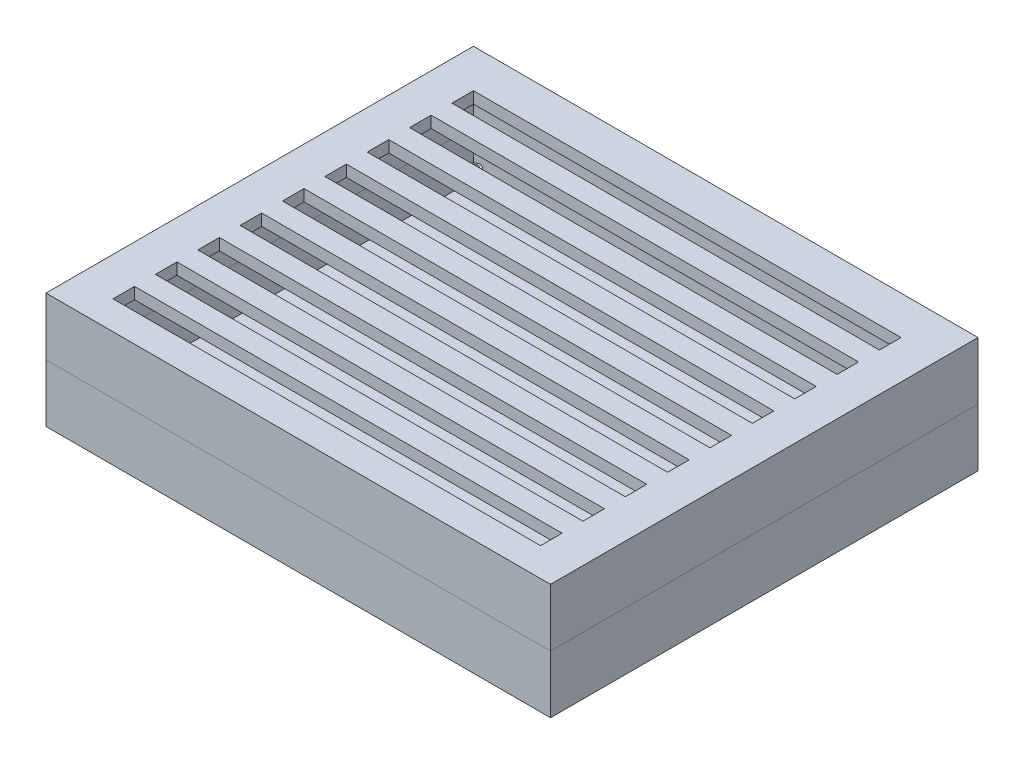
from build123d import *

# Parameters (mm, degrees)
ESBO_O1_W                    = 131
ESBO_O1_H                    = 111
ESBO_O1_W_2                  = 125
ESBO_O1_H_2                  = 105
RESSALTO_EXTRUS_O1_DEPTH     = 15
ESBO_O1_4_W                  = 125
ESBO_O1_4_H                  = 105
RESSALTO_EXTRUS_O4_DEPTH     = 3
ESBO_O2_R                    = 1.5
ESBO_O2_R_2                  = 1
RESSALTO_EXTRUS_O8_DEPTH     = 5
CORTE_EXTRUS_O4_DEPTH        = 2.5
CORTE_EXTRUS_O5_REACH        = 142.318
ESBO_O5_5_R                  = 1.5
CORTE_EXTRUS_O6_DEPTH        = 2.5
CORTE_EXTRUS_O7_REACH        = 129.198
ESBO_O8_7_R                  = 1.5
CORTE_EXTRUS_O9_DEPTH        = 2.5
CORTE_EXTRUS_O10_REACH       = 88.686
ESBO_O9_7_R                  = 1.5
RESSALTO_EXTRUS_O6_START     = 15
ESBO_O1_6_W                  = 131
ESBO_O1_6_H                  = 111
ESBO_O1_6_W_2                = 125
ESBO_O1_6_H_2                = 105
RESSALTO_EXTRUS_O6_DEPTH     = 15
RESSALTO_EXTRUS_O7_START     = 27
RESSALTO_EXTRUS_O7_OUTLINE_W = 125
RESSALTO_EXTRUS_O7_OUTLINE_H = 105
RESSALTO_EXTRUS_O7_DEPTH     = 3
ESBO_O3_W                    = 111
ESBO_O3_H                    = 5.592085676
CORTE_EXTRUS_O1_DEPTH        = 3


# Read off the part's stored shape, not the designer's step: Ressalto-extrusão7
with BuildPart() as part:
    # Esboço1 → Ressalto-extrusão1 (new body)
    with BuildSketch(Plane(origin=(0, 0, 0), x_dir=(1, 0, 0), z_dir=(0, 1, 0))):
        Rectangle(ESBO_O1_W, ESBO_O1_H)
        Rectangle(ESBO_O1_W_2, ESBO_O1_H_2, mode=Mode.SUBTRACT)
    extrude(amount=RESSALTO_EXTRUS_O1_DEPTH)

    # Esboço1<4> → Ressalto-extrusão4 (add)
    with BuildSketch(Plane(origin=(0, 0, 0), x_dir=(1, 0, 0), z_dir=(0, 1, 0))):
        Rectangle(ESBO_O1_4_W, ESBO_O1_4_H)
    extrude(amount=RESSALTO_EXTRUS_O4_DEPTH)

    # Esboço2 → Ressalto-extrusão8 (add)
    # profile 1 of 4: a face of its own
    with BuildSketch(Plane(origin=(0, 3, 0), x_dir=(1, 0, 0), z_dir=(0, 1, 0))):
        with Locations(Location((-60.1, 50.3, 0), (0, 0, 270))):
            Circle(ESBO_O2_R)
        with Locations(Location((-60.1, 50.3, 0), (0, 0, 270))):
            Circle(ESBO_O2_R_2, mode=Mode.SUBTRACT)
    # profile 2 of 4: a face of its own
    with BuildSketch(Plane(origin=(0, 3, 0), x_dir=(1, 0, 0), z_dir=(0, 1, 0))):
        with Locations(Location((60.1, 50.3, 0), (0, 0, 270))):
            Circle(ESBO_O2_R)
        with Locations(Location((60.1, 50.3, 0), (0, 0, 270))):
            Circle(ESBO_O2_R_2, mode=Mode.SUBTRACT)
    # profile 3 of 4: a face of its own
    with BuildSketch(Plane(origin=(0, 3, 0), x_dir=(1, 0, 0), z_dir=(0, 1, 0))):
        with Locations(Location((-60.1, -50.3, 0), (0, 0, 270))):
            Circle(ESBO_O2_R)
        with Locations(Location((-60.1, -50.3, 0), (0, 0, 270))):
            Circle(ESBO_O2_R_2, mode=Mode.SUBTRACT)
    # profile 4 of 4: a face of its own
    with BuildSketch(Plane(origin=(0, 3, 0), x_dir=(1, 0, 0), z_dir=(0, 1, 0))):
        with Locations(Location((60.1, -50.3, 0), (0, 0, 270))):
            Circle(ESBO_O2_R)
        with Locations(Location((60.1, -50.3, 0), (0, 0, 270))):
            Circle(ESBO_O2_R_2, mode=Mode.SUBTRACT)
    extrude(amount=RESSALTO_EXTRUS_O8_DEPTH)

    # Esboço5 → Corte-extrusão4 (cut)
    with BuildSketch(Plane(origin=(-62.5, 0, 0), x_dir=(0, 0, -1), z_dir=(1, 0, 0))):
        Polygon((-43.91228676, 6.25), (-42.324573519, 9), (-43.91228676, 11.75), (-47.08771324, 11.75), (-48.675426481, 9), (-47.08771324, 6.25), align=None)
    extrude(amount=-CORTE_EXTRUS_O4_DEPTH, mode=Mode.SUBTRACT)

    # Esboço5<5> → Corte-extrusão5 (cut, up to next)
    with BuildSketch(Plane(origin=(-62.5, 0, 0), x_dir=(0, 0, -1), z_dir=(1, 0, 0)), mode=Mode.PRIVATE) as corte_extrus_o5_sk1:
        with Locations((-45.5, 9)):
            Circle(ESBO_O5_5_R)
    corte_extrus_o5_tool1 = extrude(corte_extrus_o5_sk1.sketch, amount=-CORTE_EXTRUS_O5_REACH, mode=Mode.PRIVATE) & part.part
    add(corte_extrus_o5_tool1.solids().sort_by_distance((-62.5, 9, 45.5))[0], mode=Mode.SUBTRACT)

    # Esboço8 → Corte-extrusão6 (cut)
    with BuildSketch(Plane.XY.offset(-52.5)):
        Polygon((57.08771324, 6.25), (58.675426481, 9), (57.08771324, 11.75), (53.91228676, 11.75), (52.324573519, 9), (53.91228676, 6.25), align=None)
    extrude(amount=-CORTE_EXTRUS_O6_DEPTH, mode=Mode.SUBTRACT)

    # Esboço8<7> → Corte-extrusão7 (cut, up to next)
    with BuildSketch(Plane.XY.offset(-52.5), mode=Mode.PRIVATE) as corte_extrus_o7_sk1:
        with Locations((55.5, 9)):
            Circle(ESBO_O8_7_R)
    corte_extrus_o7_tool1 = extrude(corte_extrus_o7_sk1.sketch, amount=-CORTE_EXTRUS_O7_REACH, mode=Mode.PRIVATE) & part.part
    add(corte_extrus_o7_tool1.solids().sort_by_distance((55.5, 9, -52.5))[0], mode=Mode.SUBTRACT)

    # Esboço9 → Corte-extrusão9 (cut)
    with BuildSketch(Plane(origin=(0, 3, 0), x_dir=(-1, 0, 0), z_dir=(0, -1, 0))):
        Polygon((-53.91228676, -48.25), (-52.324573519, -45.5), (-53.91228676, -42.75), (-57.08771324, -42.75), (-58.675426481, -45.5), (-57.08771324, -48.25), align=None)
    extrude(amount=CORTE_EXTRUS_O9_DEPTH, mode=Mode.SUBTRACT)

    # Esboço9<7> → Corte-extrusão10 (cut, up to next)
    with BuildSketch(Plane(origin=(0, 3, 0), x_dir=(-1, 0, 0), z_dir=(0, -1, 0)), mode=Mode.PRIVATE) as corte_extrus_o10_sk1:
        with Locations(Location((-55.5, -45.5, 0), (0, 0, 270))):
            Circle(ESBO_O9_7_R)
    corte_extrus_o10_tool1 = extrude(corte_extrus_o10_sk1.sketch, amount=CORTE_EXTRUS_O10_REACH, mode=Mode.PRIVATE) & part.part
    add(corte_extrus_o10_tool1.solids().sort_by_distance((55.5, 3, 45.5))[0], mode=Mode.SUBTRACT)


with BuildPart() as body_2:
    # Esboço1<6> → Ressalto-extrusão6 (new body)
    with BuildSketch(Plane(origin=(0, 0, 0), x_dir=(1, 0, 0), z_dir=(0, 1, 0)).offset(RESSALTO_EXTRUS_O6_START)):
        Rectangle(ESBO_O1_6_W, ESBO_O1_6_H)
        Rectangle(ESBO_O1_6_W_2, ESBO_O1_6_H_2, mode=Mode.SUBTRACT)
    extrude(amount=RESSALTO_EXTRUS_O6_DEPTH)

    # Ressalto-extrusão7 outline → Ressalto-extrusão7 (add)
    with BuildSketch(Plane(origin=(0, 0, 0), x_dir=(1, 0, 0), z_dir=(0, 1, 0)).offset(RESSALTO_EXTRUS_O7_START)):
        Rectangle(RESSALTO_EXTRUS_O7_OUTLINE_W, RESSALTO_EXTRUS_O7_OUTLINE_H)
    extrude(amount=RESSALTO_EXTRUS_O7_DEPTH)

    # Esboço3 → Corte-extrusão1 (cut)
    with BuildSketch(Plane(origin=(0, 30, 0), x_dir=(1, 0, 0), z_dir=(0, 1, 0))):
        with Locations((0, 42.703957162)):
            Rectangle(ESBO_O3_W, ESBO_O3_H)
        with Locations((0, 31.703957162)):
            Rectangle(ESBO_O3_W, ESBO_O3_H)
        with Locations((0, 20.703957162)):
            Rectangle(ESBO_O3_W, ESBO_O3_H)
        with Locations((0, 9.703957162)):
            Rectangle(ESBO_O3_W, ESBO_O3_H)
        with Locations((0, -1.296042838)):
            Rectangle(ESBO_O3_W, ESBO_O3_H)
        with Locations((0, -12.296042838)):
            Rectangle(ESBO_O3_W, ESBO_O3_H)
        with Locations((0, -23.296042838)):
            Rectangle(ESBO_O3_W, ESBO_O3_H)
        with Locations((0, -34.296042838)):
            Rectangle(ESBO_O3_W, ESBO_O3_H)
        with Locations((0, -45.296042838)):
            Rectangle(ESBO_O3_W, ESBO_O3_H)
    extrude(amount=-CORTE_EXTRUS_O1_DEPTH, mode=Mode.SUBTRACT)


solid = Compound([part.part, body_2.part])
